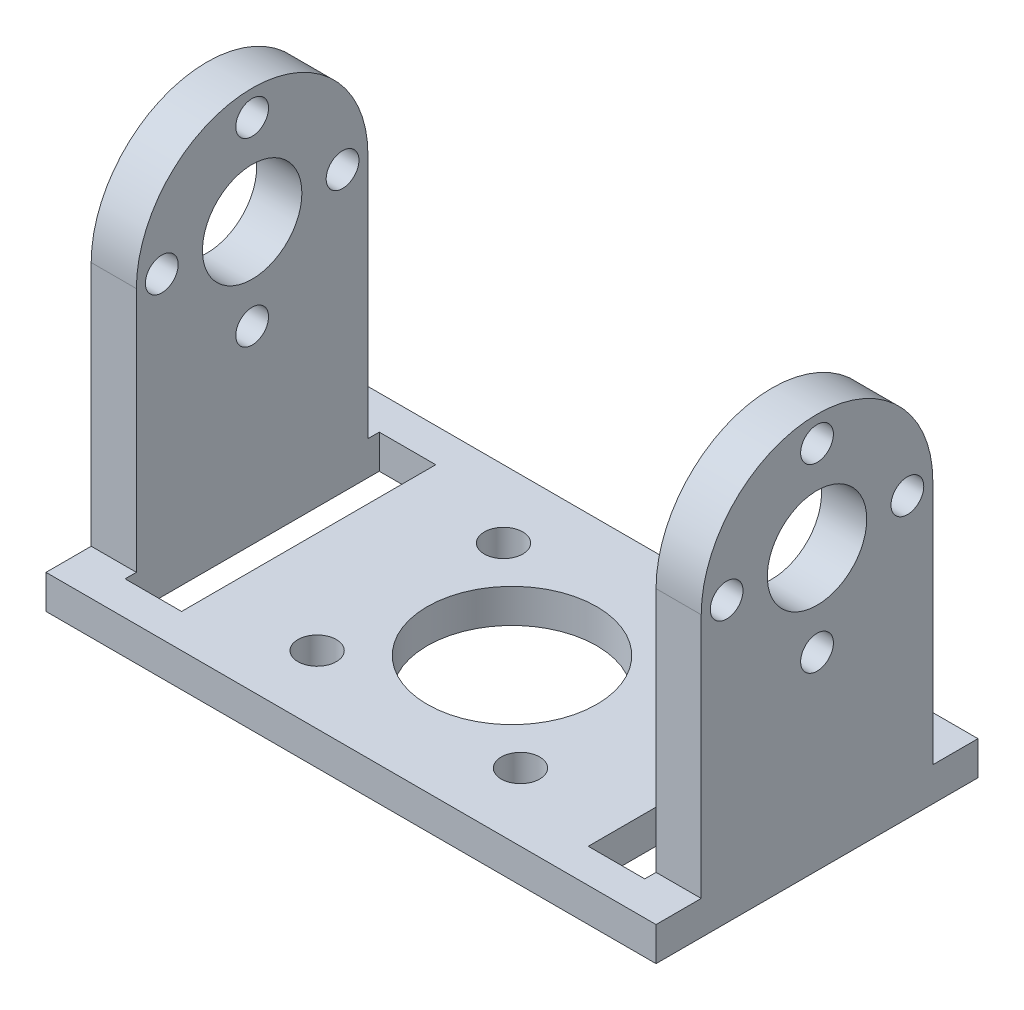
from build123d import *

# Parameters (mm, degrees)
SKETCH1_W           = 54
SKETCH1_H           = 28.5
SKETCH1_W_2         = 5
SKETCH1_H_2         = 22.5
SKETCH1_R           = 1.7
SKETCH1_R_2         = 7.5
BOSS_EXTRUDE2_DEPTH = 3
SKETCH2_W           = 4
SKETCH2_H           = 20.5
BOSS_EXTRUDE3_DEPTH = 21.75
SKETCH4_R           = 10.25
BOSS_EXTRUDE4_DEPTH = 4
SKETCH6_R           = 4.4
SKETCH6_R_2         = 1.45
CUT_EXTRUDE3_DEPTH  = 4


with BuildPart() as part:
    # Sketch1 → Boss-Extrude2 (new body)
    with BuildSketch(Plane(origin=(0, 0, 0), x_dir=(1, 0, 0), z_dir=(0, 1, 0))):
        Rectangle(SKETCH1_W, SKETCH1_H)
        with Locations((20.5, 0)):
            Rectangle(SKETCH1_W_2, SKETCH1_H_2, mode=Mode.SUBTRACT)
        with Locations((-20.5, 0)):
            Rectangle(SKETCH1_W_2, SKETCH1_H_2, mode=Mode.SUBTRACT)
        with Locations((-9, -8.25)):
            Circle(SKETCH1_R, mode=Mode.SUBTRACT)
        with Locations((9, -8.25)):
            Circle(SKETCH1_R, mode=Mode.SUBTRACT)
        with Locations((-9, 8.25)):
            Circle(SKETCH1_R, mode=Mode.SUBTRACT)
        Circle(SKETCH1_R_2, mode=Mode.SUBTRACT)
        with Locations((9, 8.25)):
            Circle(SKETCH1_R, mode=Mode.SUBTRACT)
    extrude(amount=BOSS_EXTRUDE2_DEPTH)

    # Sketch2 → Boss-Extrude3 (add)
    with BuildSketch(Plane(origin=(0, 3, 0), x_dir=(1, 0, 0), z_dir=(0, 1, 0))):
        with Locations((25, 0)):
            Rectangle(SKETCH2_W, SKETCH2_H)
    boss_extrude3 = extrude(amount=BOSS_EXTRUDE3_DEPTH)

    # Sketch4 → Boss-Extrude4 (add)
    with BuildSketch(Plane(origin=(27, 0, 0), x_dir=(0, 0, -1), z_dir=(1, 0, 0))):
        with Locations((0, 24.75)):
            Circle(SKETCH4_R)
    boss_extrude4 = extrude(amount=-BOSS_EXTRUDE4_DEPTH)

    # Mirror1: Boss-Extrude3, Boss-Extrude4 across plane
    add(boss_extrude3.mirror(Plane(origin=(0, 0, 0), x_dir=(0, 0, 1), z_dir=(1, 0, 0))))
    add(boss_extrude4.mirror(Plane(origin=(0, 0, 0), x_dir=(0, 0, 1), z_dir=(1, 0, 0))))

    # Sketch6 → Cut-Extrude3 (cut)
    with BuildSketch(Plane(origin=(27, 0, 0), x_dir=(0, 0, -1), z_dir=(1, 0, 0))):
        with Locations((0, 24.75)):
            Circle(SKETCH6_R)
        with Locations((8, 24.75)):
            Circle(SKETCH6_R_2)
        with Locations((0, 32.75)):
            Circle(SKETCH6_R_2)
        with Locations((0, 16.75)):
            Circle(SKETCH6_R_2)
        with Locations((-8, 24.75)):
            Circle(SKETCH6_R_2)
    cut_extrude3 = extrude(amount=-CUT_EXTRUDE3_DEPTH, mode=Mode.SUBTRACT)

    # Mirror3: Cut-Extrude3 across plane
    add(cut_extrude3.mirror(Plane(origin=(0, 0, 0), x_dir=(0, 0, 1), z_dir=(1, 0, 0))), mode=Mode.SUBTRACT)


solid = part.part
